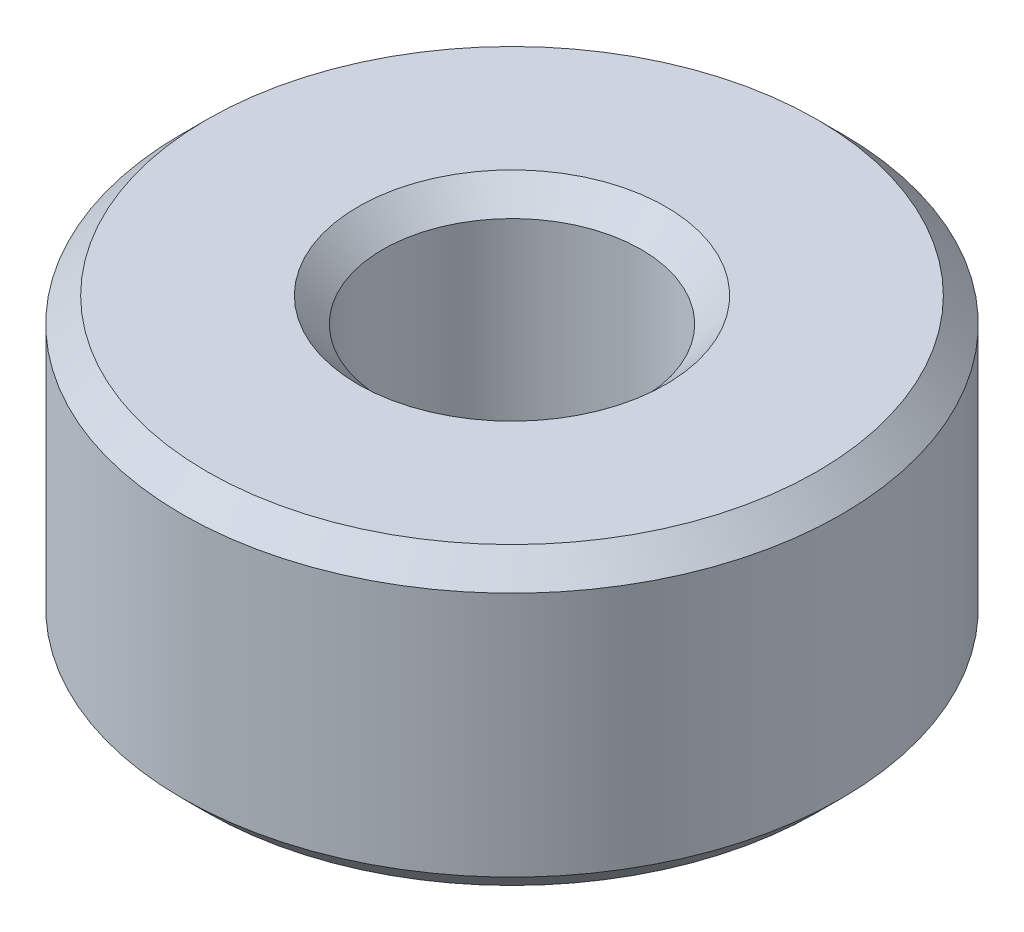
from build123d import *

# Parameters (mm, degrees)
SKETCH1_R           = 7.5
BOSS_EXTRUDE1_DEPTH = 6.716429383
SKETCH2_R           = 2.939412397
CUT_EXTRUDE1_DEPTH  = 13.554299011
CHAMFER1_SIZE       = 0.561578965


with BuildPart() as part:
    # Sketch1 → Boss-Extrude1 (new body)
    with BuildSketch(Plane(origin=(0, 0, 0), x_dir=(1, 0, 0), z_dir=(0, 1, 0))):
        Circle(SKETCH1_R)
    extrude(amount=BOSS_EXTRUDE1_DEPTH)

    # Sketch2 → Cut-Extrude1 (cut, through all)
    with BuildSketch(Plane(origin=(0, 0, 0), x_dir=(1, 0, 0), z_dir=(0, 1, 0))):
        Circle(SKETCH2_R)
    extrude(amount=CUT_EXTRUDE1_DEPTH, mode=Mode.SUBTRACT)

    # Chamfer1
    chamfer1_edges = [part.edges().sort_by_distance(p)[0] for p in [
        (-2.939412397, 6.716429383, 0),
        (-2.939412397, 0, 0),
        (-7.5, 0, 0),
        (-7.5, 6.716429383, 0),
    ]]
    chamfer(chamfer1_edges, length=CHAMFER1_SIZE)


solid = part.part
